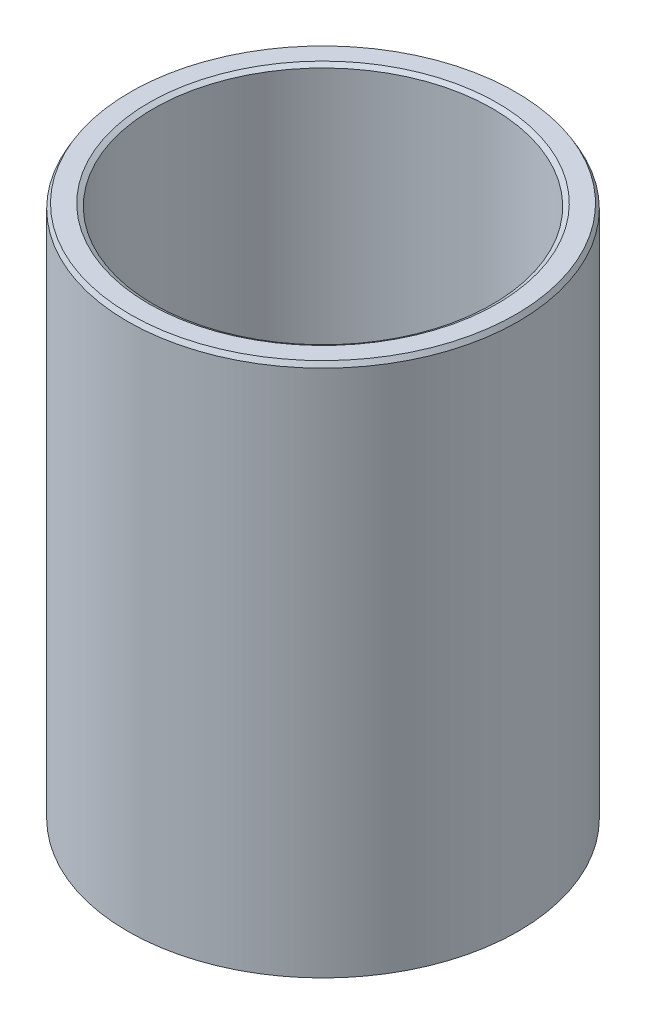
from build123d import *
from OCP.BRepFilletAPI import BRepFilletAPI_MakeChamfer

# Parameters (mm, degrees)
SKETCH1_R           = 42.5
BOSS_EXTRUDE1_DEPTH = 116.461102579
SKETCH2_R           = 36.867536126
CUT_EXTRUDE1_DEPTH  = 132.056050658
CHAMFER1_SIZE       = 1.013308566
CHAMFER1_SIZE2      = 0.585033974


with BuildPart() as part:
    # Sketch1 → Boss-Extrude1 (new body)
    with BuildSketch(Plane(origin=(0, 0, 0), x_dir=(1, 0, 0), z_dir=(0, 1, 0))):
        Circle(SKETCH1_R)
    extrude(amount=BOSS_EXTRUDE1_DEPTH)

    # Sketch2 → Cut-Extrude1 (cut, through all)
    with BuildSketch(Plane(origin=(0, 0, 0), x_dir=(1, 0, 0), z_dir=(0, 1, 0))):
        Circle(SKETCH2_R)
    extrude(amount=CUT_EXTRUDE1_DEPTH, mode=Mode.SUBTRACT)

    # Chamfer1: one chamfer whose edges measure the first distance from different faces: ONE call of the kernel's chamfer builder (chamfer() names one face for all edges)
    chamfer1_edges_1 = [part.edges().sort_by_distance(p)[0] for p in [
        (-36.867536126, 116.461102579, 0),
    ]]
    chamfer1_side_1 = [part.faces().sort_by_distance(p)[0] for p in [
        (-41.297918472, 116.461102579, 0),
    ]]
    chamfer1_edges_2 = [part.edges().sort_by_distance(p)[0] for p in [
        (-36.867536126, 0, 0),
    ]]
    chamfer1_side_2 = [part.faces().sort_by_distance(p)[0] for p in [
        (-36.867536126, 58.23055129, 0),
    ]]
    chamfer1_edges_3 = [part.edges().sort_by_distance(p)[0] for p in [
        (-42.5, 0, 0),
    ]]
    chamfer1_side_3 = [part.faces().sort_by_distance(p)[0] for p in [
        (-41.297918472, 0, 0),
    ]]
    chamfer1_edges_4 = [part.edges().sort_by_distance(p)[0] for p in [
        (-42.5, 116.461102579, 0),
    ]]
    chamfer1_side_4 = [part.faces().sort_by_distance(p)[0] for p in [
        (-42.5, 58.23055129, 0),
    ]]
    chamfer1 = BRepFilletAPI_MakeChamfer(part.part.solid().wrapped)
    for e in chamfer1_edges_1:
        chamfer1.Add(CHAMFER1_SIZE, CHAMFER1_SIZE2, e.wrapped, chamfer1_side_1[0].wrapped)  # the first distance lies on this face
    for e in chamfer1_edges_2:
        chamfer1.Add(CHAMFER1_SIZE, CHAMFER1_SIZE2, e.wrapped, chamfer1_side_2[0].wrapped)  # the first distance lies on this face
    for e in chamfer1_edges_3:
        chamfer1.Add(CHAMFER1_SIZE, CHAMFER1_SIZE2, e.wrapped, chamfer1_side_3[0].wrapped)  # the first distance lies on this face
    for e in chamfer1_edges_4:
        chamfer1.Add(CHAMFER1_SIZE, CHAMFER1_SIZE2, e.wrapped, chamfer1_side_4[0].wrapped)  # the first distance lies on this face
    add(Compound.cast(chamfer1.Shape()), mode=Mode.REPLACE)


solid = part.part
